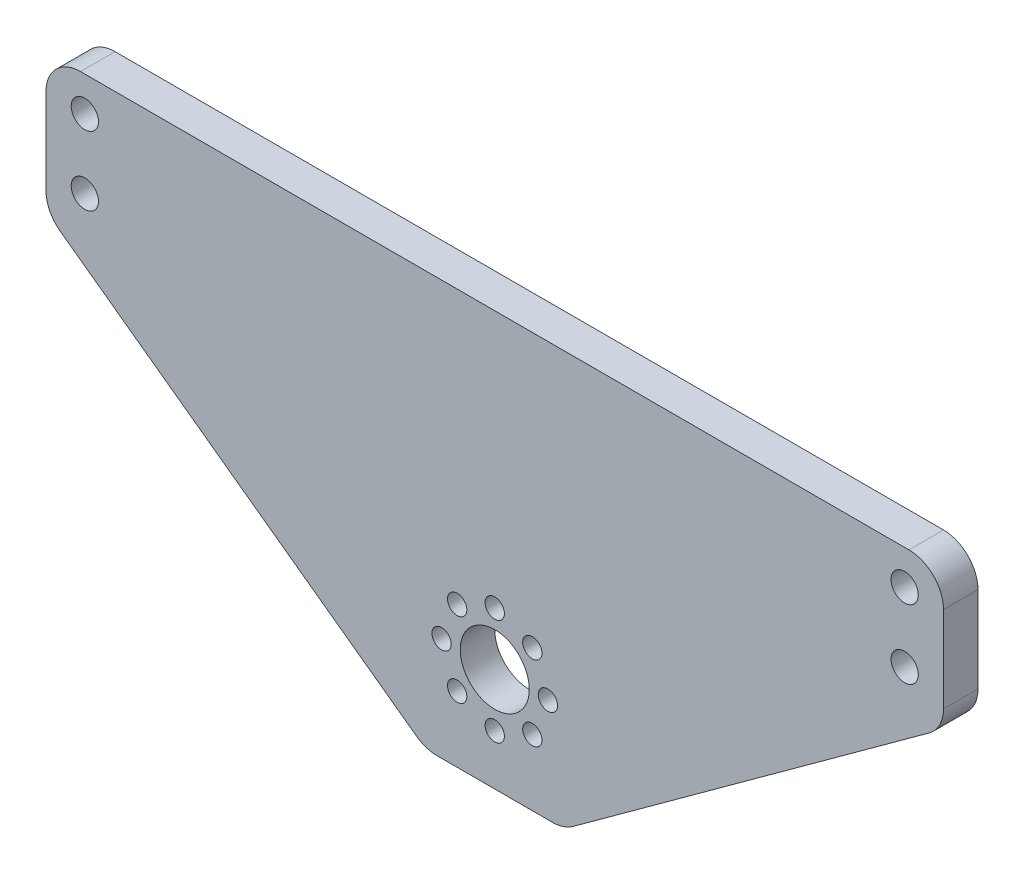
from build123d import *

# Parameters (mm, degrees)
SKETCH1_W           = 165.1
SKETCH1_H           = 76.2
SKETCH1_R           = 6.35
SKETCH1_R_2         = 2.50825
BOSS_EXTRUDE1_DEPTH = 6.35
CUT_EXTRUDE1_DEPTH  = 6.35
FILLET1_R           = 6.35
SKETCH3_R           = 1.778
CUT_EXTRUDE2_DEPTH  = 6.35
CIRPATTERN1_COUNT   = 8


with BuildPart() as part:
    # Sketch1 → Boss-Extrude1 (new body)
    with BuildSketch(Plane.XY):
        Rectangle(SKETCH1_W, SKETCH1_H)
        with Locations((0, -19.05)):
            Circle(SKETCH1_R, mode=Mode.SUBTRACT)
        with Locations((-75.40625, 31.75)):
            Circle(SKETCH1_R_2, mode=Mode.SUBTRACT)
        with Locations((75.40625, 31.75)):
            Circle(SKETCH1_R_2, mode=Mode.SUBTRACT)
        with Locations((75.40625, 19.05)):
            Circle(SKETCH1_R_2, mode=Mode.SUBTRACT)
        with Locations((-75.40625, 19.05)):
            Circle(SKETCH1_R_2, mode=Mode.SUBTRACT)
    extrude(amount=BOSS_EXTRUDE1_DEPTH)

    # Sketch2 → Cut-Extrude1 (cut)
    with BuildSketch(Plane(origin=(0, 0, 0), x_dir=(-1, 0, 0), z_dir=(0, 0, -1))):
        Polygon((12.7, -38.1), (82.55, 12.7), (82.55, -38.1), align=None)
        Polygon((-82.55, -38.1), (-82.55, 12.7), (-12.7, -38.1), align=None)
    extrude(amount=-CUT_EXTRUDE1_DEPTH, mode=Mode.SUBTRACT)

    # Fillet1
    fillet1_edges = [part.edges().sort_by_distance(p)[0] for p in [
        (-82.55, 38.1, 3.175),
        (82.55, 12.7, 3.175),
        (-82.55, 12.7, 3.175),
        (-12.7, -38.1, 3.175),
        (12.7, -38.1, 3.175),
        (82.55, 38.1, 3.175),
    ]]
    fillet(fillet1_edges, radius=FILLET1_R)

    # Sketch3 → Cut-Extrude2 (cut)
    with BuildSketch(Plane(origin=(0, 0, 0), x_dir=(-1, 0, 0), z_dir=(0, 0, -1))):
        with Locations((0, -9.271)):
            Circle(SKETCH3_R)
    cut_extrude2 = extrude(amount=-CUT_EXTRUDE2_DEPTH, mode=Mode.SUBTRACT)

    # CirPattern1: Cut-Extrude2 ×8 about axis
    cirpattern1_axis = Axis((0, -19.05, 0), (0, 0, 1))
    for i in range(1, CIRPATTERN1_COUNT):
        add(cut_extrude2.rotate(cirpattern1_axis, i * 360 / CIRPATTERN1_COUNT), mode=Mode.SUBTRACT)


solid = part.part
